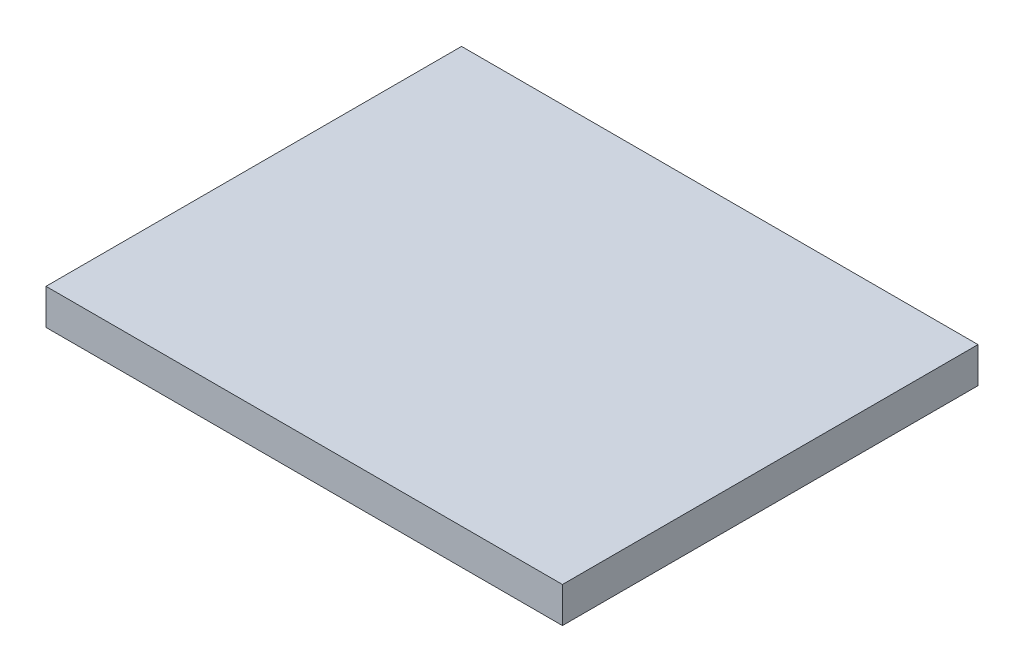
from build123d import *

# Parameters (mm, degrees)
SKETCH1_W           = 87
SKETCH1_H           = 70
BOSS_EXTRUDE1_DEPTH = 6


with BuildPart() as part:
    # Sketch1 → Boss-Extrude1 (new body)
    with BuildSketch(Plane(origin=(0, 0, 0), x_dir=(1, 0, 0), z_dir=(0, 1, 0))):
        with Locations((-146.443820225, 17.5)):
            Rectangle(SKETCH1_W, SKETCH1_H)
    extrude(amount=BOSS_EXTRUDE1_DEPTH)


solid = part.part
